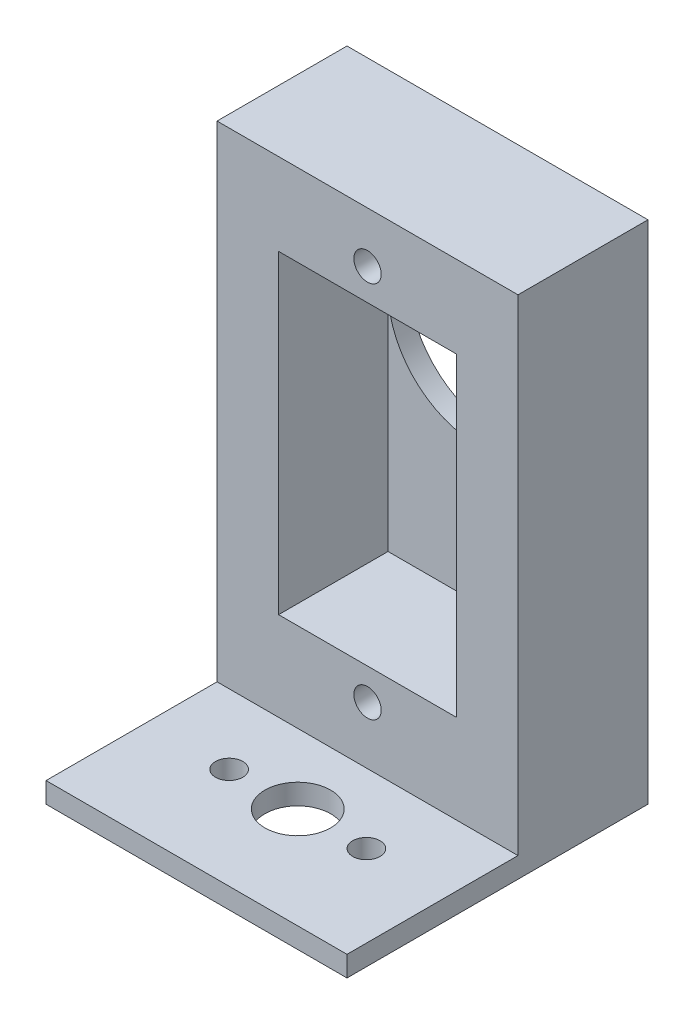
from build123d import *

# Parameters (mm, degrees)
SKETCH1_W           = 22
SKETCH1_H           = 22
BOSS_EXTRUDE1_DEPTH = 37
SKETCH3_W           = 12.5
SKETCH3_H           = 35.5
CUT_EXTRUDE2_DEPTH  = 45.429719783
SKETCH18_R          = 2.4
SKETCH18_R_2        = 1
CUT_EXTRUDE10_DEPTH = 39.758869953
SKETCH9_W           = 13
SKETCH9_H           = 23
CUT_EXTRUDE4_DEPTH  = 8
SKETCH10_R          = 6.5
CUT_EXTRUDE5_DEPTH  = 44.706406853
SKETCH11_R          = 1
CUT_EXTRUDE6_DEPTH  = 8


with BuildPart() as part:
    # Sketch1 → Boss-Extrude1 (new body)
    with BuildSketch(Plane(origin=(0, 0, 0), x_dir=(1, 0, 0), z_dir=(0, 1, 0))):
        Rectangle(SKETCH1_W, SKETCH1_H)
    extrude(amount=BOSS_EXTRUDE1_DEPTH)

    # Sketch3 → Cut-Extrude2 (cut, through all)
    with BuildSketch(Plane(origin=(11, 0, 0), x_dir=(0, 0, -1), z_dir=(1, 0, 0))):
        with Locations((-4.75, 19.25)):
            Rectangle(SKETCH3_W, SKETCH3_H)
    extrude(amount=-CUT_EXTRUDE2_DEPTH, mode=Mode.SUBTRACT)

    # Sketch18 → Cut-Extrude10 (cut, through all)
    with BuildSketch(Plane(origin=(0, 1.5, 0), x_dir=(1, 0, 0), z_dir=(0, 1, 0))):
        with Locations((0, -3.599880566)):
            Circle(SKETCH18_R)
        with Locations((5.015878655, -3.599880566)):
            Circle(SKETCH18_R_2)
        with Locations((-5.015878655, -3.599880566)):
            Circle(SKETCH18_R_2)
    extrude(amount=-CUT_EXTRUDE10_DEPTH, mode=Mode.SUBTRACT)

    # Sketch9 → Cut-Extrude4 (cut)
    with BuildSketch(Plane.XY.offset(-1.5)):
        with Locations((0, 19.5)):
            Rectangle(SKETCH9_W, SKETCH9_H)
    extrude(amount=-CUT_EXTRUDE4_DEPTH, mode=Mode.SUBTRACT)

    # Sketch10 → Cut-Extrude5 (cut, through all)
    with BuildSketch(Plane.XY.offset(-9.5)):
        with Locations((0, 24.5)):
            Circle(SKETCH10_R)
    extrude(amount=-CUT_EXTRUDE5_DEPTH, mode=Mode.SUBTRACT)

    # Sketch11 → Cut-Extrude6 (cut)
    with BuildSketch(Plane.XY.offset(-1.5)):
        with Locations((0, 33.3)):
            Circle(SKETCH11_R)
        with Locations((0, 5.7)):
            Circle(SKETCH11_R)
    extrude(amount=-CUT_EXTRUDE6_DEPTH, mode=Mode.SUBTRACT)


solid = part.part
